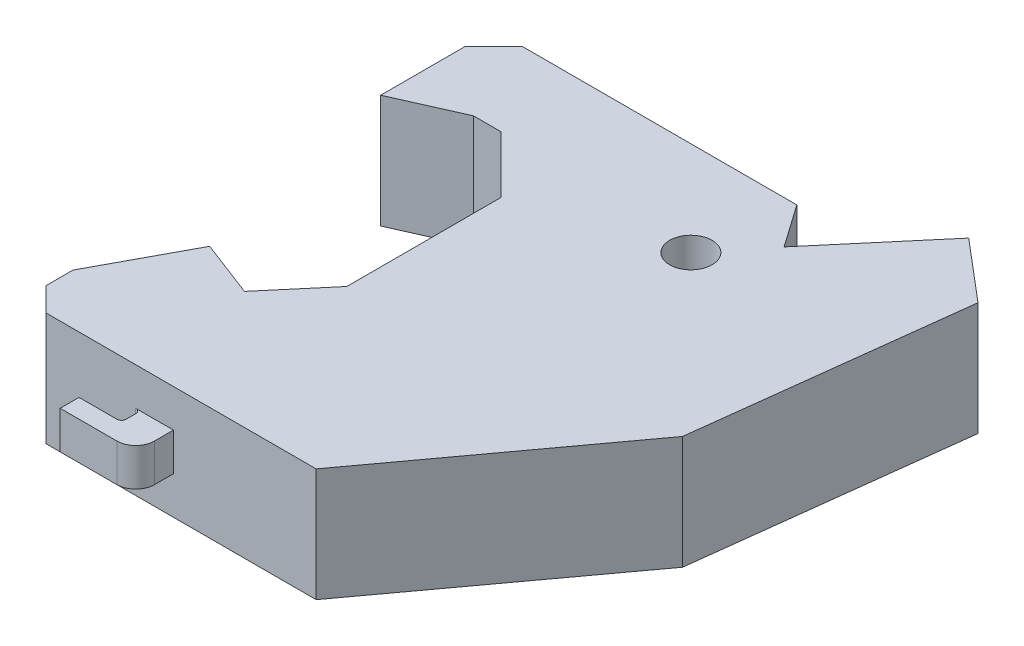
from build123d import *

# Parameters (mm, degrees)
SKETCH1_R           = 2.25
BOSS_EXTRUDE1_DEPTH = 12
SKETCH2_W           = 8
SKETCH2_H           = 4
BOSS_EXTRUDE2_DEPTH = 4
CUT_EXTRUDE1_DEPTH  = 6
CUT_EXTRUDE2_DEPTH  = 77.446541714


with BuildPart() as part:
    # Sketch1 → Boss-Extrude1 (new body)
    with BuildSketch(Plane(origin=(0, 0, 0), x_dir=(1, 0, 0), z_dir=(0, 1, 0))):
        Polygon((0, 0), (0, 5.363078535), (5.059307402, 14.779862519), (11.036526408, 12.484886809), (16.007683728, 18.356247912), (16.007683728, 34.666400912), (9.953212595, 40.720872045), (7.064267003, 40.720872045), (0.254919589, 37.693636479), (0.254919589, 46.668992062), (3.258374293, 49.672446766), (32.361506358, 49.672446766), (35.537323274, 45.146080758), (44.50389869, 55.736371659), (50.92671808, 50.298306266), (47.546574195, 22.382097611), (31.116613422, 0), align=None)
        with Locations((31.116613422, 39.692144587)):
            Circle(SKETCH1_R, mode=Mode.SUBTRACT)
    extrude(amount=BOSS_EXTRUDE1_DEPTH)

    # Sketch2 → Boss-Extrude2 (add)
    with BuildSketch(Plane.XY):
        with Locations((12, 6)):
            Rectangle(SKETCH2_W, SKETCH2_H)
    extrude(amount=BOSS_EXTRUDE2_DEPTH)

    # Sketch3 → Cut-Extrude1 (cut)
    with BuildSketch(Plane(origin=(0, 8, 0), x_dir=(1, 0, 0), z_dir=(0, 1, 0))):
        with BuildLine():
            Line((8, 0), (12, 0))
            ThreePointArc((12, 0), (12.353553391, -0.146446609), (12.5, -0.5))
            Line((12.5, -0.5), (12.5, -1.5))
            ThreePointArc((12.5, -1.5), (12.353553391, -1.853553391), (12, -2))
            Line((12, -2), (8, -2))
            Line((8, -2), (8, 0))
        make_face()
        with BuildLine():
            Line((14, -4), (16, -4))
            Line((16, -4), (16, -2))
            ThreePointArc((16, -2), (15.414213562, -3.414213562), (14, -4))
        make_face()
    extrude(amount=-CUT_EXTRUDE1_DEPTH, mode=Mode.SUBTRACT)

    # Sketch4 → Cut-Extrude2 (cut, through all)
    with BuildSketch(Plane(origin=(0, 12, 0), x_dir=(1, 0, 0), z_dir=(0, 1, 0))):
        Polygon((0, 0), (0, 2.5), (2.5, 0), align=None)
    extrude(amount=-CUT_EXTRUDE2_DEPTH, mode=Mode.SUBTRACT)


solid = part.part
